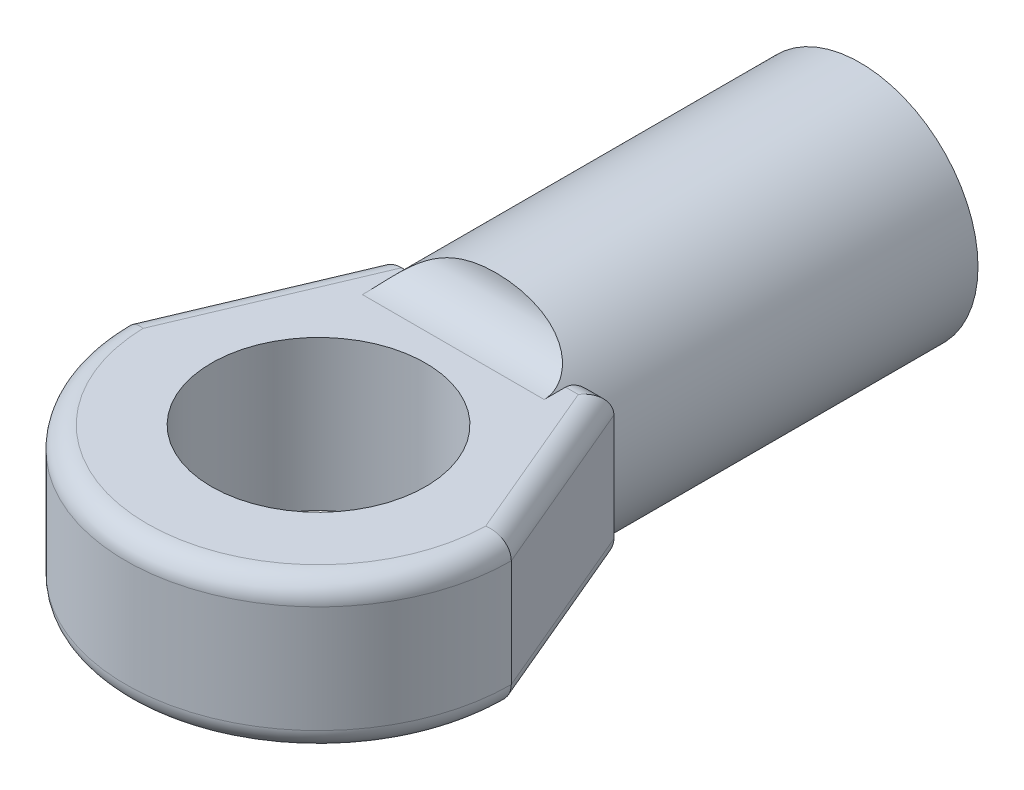
from build123d import *

# Parameters (mm, degrees)
EXTRUDE_1_DEPTH     = 3.5
SKETCH_2_R          = 2.75
EXTRUDE_2_DEPTH     = 8.5
FILLET_1_R          = 1
FILLET_2_R          = 1
SKETCH_3_R          = 2.5
CUT_EXTRUDE_1_DEPTH = 15.156827953
FILLET_3_R          = 0.5


with BuildPart() as part:
    # ｽｹｯﾁ1 → ﾎﾞｽ - 押し出し1 (new body)
    with BuildSketch(Plane(origin=(0, 0, 0), x_dir=(1, 0, 0), z_dir=(0, 1, 0))):
        Polygon((-4.5, 0), (0, 0), (0, 4.145780988), (-2.75, 4.145780988), align=None)
        with BuildLine():
            Line((4.5, 0), (0, 0))
            Line((0, 0), (-4.5, 0))
            ThreePointArc((-4.5, 0), (0, -4.5), (4.5, 0))
        make_face()
        Polygon((2.75, 4.145780988), (4.5, 0), (0, 0), (0, 4.145780988), align=None)
    extrude(amount=EXTRUDE_1_DEPTH)

    # ｽｹｯﾁ2 → ﾎﾞｽ - 押し出し2 (add)
    with BuildSketch(Plane(origin=(0, 0, -4.145780988), x_dir=(-1, 0, 0), z_dir=(0, 0, -1))):
        with Locations((0, 1.75)):
            Circle(SKETCH_2_R)
    extrude(amount=EXTRUDE_2_DEPTH)

    # ﾌｨﾚｯﾄ1
    # the kernel refuses this fillet: 1 mm, written as the material it adds along each edge
    with BuildSketch(Plane(origin=(4.621320344, 0, -4.145780988), x_dir=(0, 0, 1), z_dir=(-1, 0, 0))) as fillet_1_piece_1_section:
        with BuildLine():
            CenterArc((FILLET_1_R, -FILLET_1_R), FILLET_1_R, 90, 90)
            Line((0, -FILLET_1_R), (0, 0))
            Line((0, 0), (FILLET_1_R, 0))
        make_face()
    fillet_1_piece_1 = extrude(amount=9.242640687, mode=Mode.PRIVATE)
    fillet_1_piece_1 = fillet_1_piece_1 & Plane(origin=(0, 1.75, -3.914317748), x_dir=(-1, 0, 0), z_dir=(0, 0, 1)) * Cylinder(2.75, 23, mode=Mode.PRIVATE)
    add(fillet_1_piece_1)

    # ﾌｨﾚｯﾄ2
    # the kernel refuses this fillet: 1 mm, written as the material it adds along each edge
    with BuildSketch(Plane(origin=(-4.621320344, 3.5, -4.145780988), x_dir=(0, 1, 0), z_dir=(1, 0, 0))) as fillet_2_piece_1_section:
        with BuildLine():
            CenterArc((FILLET_2_R, FILLET_2_R), FILLET_2_R, 180, 90)
            Line((0, FILLET_2_R), (0, 0))
            Line((0, 0), (FILLET_2_R, 0))
        make_face()
    fillet_2_piece_1 = extrude(amount=9.242640687, mode=Mode.PRIVATE)
    fillet_2_piece_1 = fillet_2_piece_1 & Plane(origin=(0, 1.75, -3.91431771), x_dir=(-1, 0, 0), z_dir=(0, 0, 1)) * Cylinder(2.75, 23, mode=Mode.PRIVATE)
    add(fillet_2_piece_1)

    # ｽｹｯﾁ3 → ｶｯﾄ - 押し出し1 (cut, through all)
    with BuildSketch(Plane(origin=(0, 3.5, 0), x_dir=(1, 0, 0), z_dir=(0, 1, 0))):
        with Locations(Location((0, 0, 0), (0, 0, 270))):
            Circle(SKETCH_3_R)
    extrude(amount=-CUT_EXTRUDE_1_DEPTH, mode=Mode.SUBTRACT)

    # ﾌｨﾚｯﾄ3
    # the kernel refuses this fillet: 0.5 mm, written as the material it takes off along each edge
    with BuildSketch(Plane(origin=(-0.871320344, 0, -4.145780988), x_dir=(0, 1, 0), z_dir=(-1, 0, 0))) as fillet_3_piece_1_section:
        with BuildLine():
            CenterArc((FILLET_3_R, -FILLET_3_R), FILLET_3_R, 90, 90)
            Line((0, -FILLET_3_R), (0, 0))
            Line((0, 0), (FILLET_3_R, 0))
        make_face()
    fillet_3_piece_1 = extrude(amount=3.128679656, mode=Mode.PRIVATE)
    fillet_3_piece_1 = fillet_3_piece_1 - Plane(origin=(0, 1.75, -4.02149164), x_dir=(-1, 0, 0), z_dir=(0, 0, 1)) * Cylinder(2.75, 9, mode=Mode.PRIVATE)
    add(fillet_3_piece_1, mode=Mode.SUBTRACT)
    with BuildSketch(Plane(origin=(-2.263888889, 0, -5.297386818), x_dir=(0, 1, 0), z_dir=(-0.3888888888844502, 0, 0.9212846639894848))) as fillet_3_piece_2_section:
        with BuildLine():
            CenterArc((FILLET_3_R, -FILLET_3_R), FILLET_3_R, 90, 90)
            Line((0, -FILLET_3_R), (0, 0))
            Line((0, 0), (FILLET_3_R, 0))
        make_face()
    fillet_3_piece_2 = extrude(amount=7, mode=Mode.PRIVATE)
    fillet_3_piece_2 = split(fillet_3_piece_2, bisect_by=Plane(origin=(-2.809521529, 0.121561121, -4.145780988), z_dir=(0, 0, 1)), keep=Keep.TOP, mode=Mode.PRIVATE)
    add(fillet_3_piece_2, mode=Mode.SUBTRACT)
    with BuildSketch(Plane(origin=(0, 0, 0), x_dir=(-0.9615445935244931, 0, -0.2746488570225942), z_dir=(0.2746488570225942, 0, -0.9615445935244931))) as fillet_3_piece_3:
        with BuildLine():
            CenterArc((4.5 - FILLET_3_R, FILLET_3_R), FILLET_3_R, 270, 90)
            Line((4.5 - FILLET_3_R, 0), (4.5, 0))
            Line((4.5, 0), (4.5, FILLET_3_R))
        make_face()
    revolve(axis=Axis((0, 0, 0), (0, 1, 0)), revolution_arc=211.882178867, mode=Mode.SUBTRACT)
    with BuildSketch(Plane(origin=(2.263888889, 0, -5.297386818), x_dir=(0, 1, 0), z_dir=(0.3888888888844502, 0, 0.9212846639894848))) as fillet_3_piece_4_section:
        with BuildLine():
            CenterArc((FILLET_3_R, FILLET_3_R), FILLET_3_R, 180, 90)
            Line((0, FILLET_3_R), (0, 0))
            Line((0, 0), (FILLET_3_R, 0))
        make_face()
    fillet_3_piece_4 = extrude(amount=7, mode=Mode.PRIVATE)
    fillet_3_piece_4 = split(fillet_3_piece_4, bisect_by=Plane(origin=(2.809522327, 0.121559787, -4.145780988), z_dir=(0, 0, 1)), keep=Keep.TOP, mode=Mode.PRIVATE)
    add(fillet_3_piece_4, mode=Mode.SUBTRACT)
    with BuildSketch(Plane(origin=(4, 0, -4.145780988), x_dir=(0, 1, 0), z_dir=(-1, 0, 0))) as fillet_3_piece_5_section:
        with BuildLine():
            CenterArc((FILLET_3_R, -FILLET_3_R), FILLET_3_R, 90, 90)
            Line((0, -FILLET_3_R), (0, 0))
            Line((0, 0), (FILLET_3_R, 0))
        make_face()
    fillet_3_piece_5 = extrude(amount=3.128679656, mode=Mode.PRIVATE)
    fillet_3_piece_5 = fillet_3_piece_5 - Plane(origin=(0, 1.75, -4.021491718), x_dir=(-1, 0, 0), z_dir=(0, 0, 1)) * Cylinder(2.75, 9, mode=Mode.PRIVATE)
    add(fillet_3_piece_5, mode=Mode.SUBTRACT)
    with BuildSketch(Plane(origin=(0.871320344, 3.5, -4.145780988), x_dir=(0, 0, 1), z_dir=(1, 0, 0))) as fillet_3_piece_6_section:
        with BuildLine():
            CenterArc((FILLET_3_R, FILLET_3_R), FILLET_3_R, 180, 90)
            Line((0, FILLET_3_R), (0, 0))
            Line((0, 0), (FILLET_3_R, 0))
        make_face()
    fillet_3_piece_6 = extrude(amount=3.128679656, mode=Mode.PRIVATE)
    fillet_3_piece_6 = fillet_3_piece_6 - Plane(origin=(0, 1.75, -4.021491695), x_dir=(-1, 0, 0), z_dir=(0, 0, 1)) * Cylinder(2.75, 9, mode=Mode.PRIVATE)
    add(fillet_3_piece_6, mode=Mode.SUBTRACT)
    with BuildSketch(Plane(origin=(-2.263888889, 3.5, -5.297386818), x_dir=(0.9212846639894847, 0, 0.38888888888445017), z_dir=(-0.3888888888844502, 0, 0.9212846639894848))) as fillet_3_piece_7_section:
        with BuildLine():
            CenterArc((FILLET_3_R, -FILLET_3_R), FILLET_3_R, 90, 90)
            Line((0, -FILLET_3_R), (0, 0))
            Line((0, 0), (FILLET_3_R, 0))
        make_face()
    fillet_3_piece_7 = extrude(amount=7, mode=Mode.PRIVATE)
    fillet_3_piece_7 = split(fillet_3_piece_7, bisect_by=Plane(origin=(-2.809521492, 3.378439196, -4.145780988), z_dir=(0, 0, 1)), keep=Keep.TOP, mode=Mode.PRIVATE)
    add(fillet_3_piece_7, mode=Mode.SUBTRACT)
    with BuildSketch(Plane(origin=(0, 3.5, 0), x_dir=(-0.9615445935244931, 0, -0.2746488570225942), z_dir=(0.2746488570225942, 0, -0.9615445935244931))) as fillet_3_piece_8:
        with BuildLine():
            CenterArc((4.5 - FILLET_3_R, -FILLET_3_R), FILLET_3_R, 0, 90)
            Line((4.5, -FILLET_3_R), (4.5, 0))
            Line((4.5, 0), (4.5 - FILLET_3_R, 0))
        make_face()
    revolve(axis=Axis((0, 3.5, 0), (0, 1, 0)), revolution_arc=211.882178867, mode=Mode.SUBTRACT)
    with BuildSketch(Plane(origin=(2.263888889, 3.5, -5.297386818), x_dir=(-0.9212846639894847, 0, 0.38888888888445017), z_dir=(0.3888888888844502, 0, 0.9212846639894848))) as fillet_3_piece_9_section:
        with BuildLine():
            CenterArc((FILLET_3_R, FILLET_3_R), FILLET_3_R, 180, 90)
            Line((0, FILLET_3_R), (0, 0))
            Line((0, 0), (FILLET_3_R, 0))
        make_face()
    fillet_3_piece_9 = extrude(amount=7, mode=Mode.PRIVATE)
    fillet_3_piece_9 = split(fillet_3_piece_9, bisect_by=Plane(origin=(2.80952229, 3.37844053, -4.145780988), z_dir=(0, 0, 1)), keep=Keep.TOP, mode=Mode.PRIVATE)
    add(fillet_3_piece_9, mode=Mode.SUBTRACT)


solid = part.part
